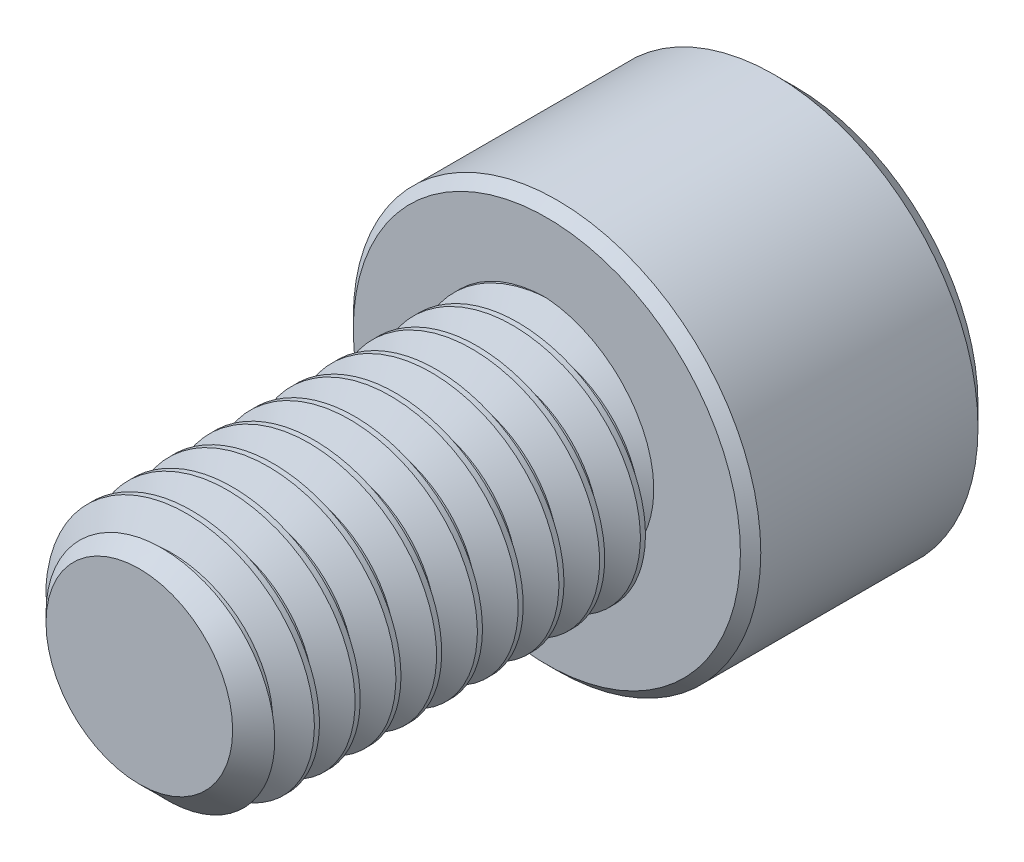
from build123d import *

# Parameters (mm, degrees)
SKETCH1_R          = 2.413
EXTRUDE1_DEPTH     = 7.9375
CHAMFER3_SIZE      = 0.5953125
CUT_SWEEP1_PITCH   = 0.79375
SKETCH6_R          = 3.96875
EXTRUDE2_DEPTH     = 4.826
CUT_EXTRUDE1_DEPTH = 2.9765625
CHAMFER1_SIZE      = 0.396875
CHAMFER2_SIZE      = 0.1984375


with BuildPart() as part:
    # Sketch1 → Extrude1 (new body)
    with BuildSketch(Plane.XY):
        Circle(SKETCH1_R)
    extrude(amount=-EXTRUDE1_DEPTH)

    # Chamfer3
    chamfer3_edges = [part.edges().sort_by_distance(p)[0] for p in [
        (-2.413, 0, 0),
    ]]
    chamfer(chamfer3_edges, length=CHAMFER3_SIZE)

    # Cut-Sweep1: the profile of Sketch3 profile screwed along a right-hand helix of 11 turns, 6 arcs to a turn; built about Z, then put on its axis
    cut_sweep1_z = Axis((0, 0, 0), (0, 0, 1))
    cut_sweep1_corners = [(2.4133, 0, -0.694704455), (1.897444252, 0, -0.396875), (1.897444252, 0, -0.29765625), (2.4133, 0, 0.000173205)]
    with BuildLine(mode=Mode.PRIVATE) as cut_sweep1_profile:
        Line(cut_sweep1_corners[0], cut_sweep1_corners[1])
        Line(cut_sweep1_corners[1], cut_sweep1_corners[2])
        Line(cut_sweep1_corners[2], cut_sweep1_corners[3])
        Line(cut_sweep1_corners[3], cut_sweep1_corners[0])
    cut_sweep1_cap = Face(cut_sweep1_profile.wire())
    cut_sweep1_turn_angles = [0, 30, 60, 90, 120, 150, 180, 210, 240, 270, 300, 330, 360]
    cut_sweep1_turn_weights = [1, 0.8660254037844387, 1, 0.8660254037844387, 1, 0.8660254037844387, 1, 0.8660254037844387, 1, 0.8660254037844387, 1, 0.8660254037844387, 1]
    cut_sweep1_turn_rails = [Edge.make_bspline([Vector(p[0], p[1], 0).rotate(cut_sweep1_z, cut_sweep1_turn_angles[k]) / cut_sweep1_turn_weights[k] + Vector(0, 0, p[2] + CUT_SWEEP1_PITCH * cut_sweep1_turn_angles[k] / 360) for k in range(13)], [0, 0, 0, 1, 1, 2, 2, 3, 3, 4, 4, 5, 5, 6, 6, 6], 2, cut_sweep1_turn_weights) for p in cut_sweep1_corners]
    cut_sweep1_turn_sides = [Face.make_surface_from_curves(cut_sweep1_turn_rails[p[0]], cut_sweep1_turn_rails[p[1]]) for p in [(0, 1), (1, 2), (2, 3), (3, 0)]]
    cut_sweep1 = Plane(origin=(0, 0, 0), x_dir=(0, 1, 0), z_dir=(0, 0, -1)) * Solid(Shell([*[p.moved(Location((0, 0, CUT_SWEEP1_PITCH * i))) for i in range(11) for p in cut_sweep1_turn_sides], cut_sweep1_cap, cut_sweep1_cap.rotate(cut_sweep1_z, 3960).moved(Location((0, 0, CUT_SWEEP1_PITCH * 3960 / 360)))]))
    add(cut_sweep1, mode=Mode.SUBTRACT)

    # Sketch6 → Extrude2 (add)
    with BuildSketch(Plane(origin=(0, 0, -7.9375), x_dir=(-1, 0, 0), z_dir=(0, 0, -1))):
        Circle(SKETCH6_R)
    extrude(amount=EXTRUDE2_DEPTH)

    # Sketch7 → Cut-Extrude1 (cut)
    with BuildSketch(Plane(origin=(0, 0, -12.7635), x_dir=(-1, 0, 0), z_dir=(0, 0, -1))):
        Polygon((0, 2.291358881), (-1.984375, 1.14567944), (-1.984375, -1.14567944), (0, -2.291358881), (1.984375, -1.14567944), (1.984375, 1.14567944), align=None)
    extrude(amount=-CUT_EXTRUDE1_DEPTH, mode=Mode.SUBTRACT)

    # Cut-Extrude2 cone 1 section (through the dimple's axis) → Cut-Extrude2 (revolve, cut)
    with BuildSketch(Plane(origin=(0, 0, -12.7635), x_dir=(0, 1, 0), z_dir=(1, 0, 0))):
        Polygon((0, 0), (2.291358881, 0), (0, 2.291358881), align=None)
    revolve(axis=Axis((0, 0, -12.7635), (0, 0, 1)), mode=Mode.SUBTRACT)

    # Chamfer1
    chamfer1_edges = [part.edges().sort_by_distance(p)[0] for p in [
        (3.96875, 0, -12.7635),
    ]]
    chamfer(chamfer1_edges, length=CHAMFER1_SIZE)

    # Chamfer2
    chamfer2_edges = [part.edges().sort_by_distance(p)[0] for p in [
        (3.96875, 0, -7.9375),
    ]]
    chamfer(chamfer2_edges, length=CHAMFER2_SIZE)


solid = part.part
